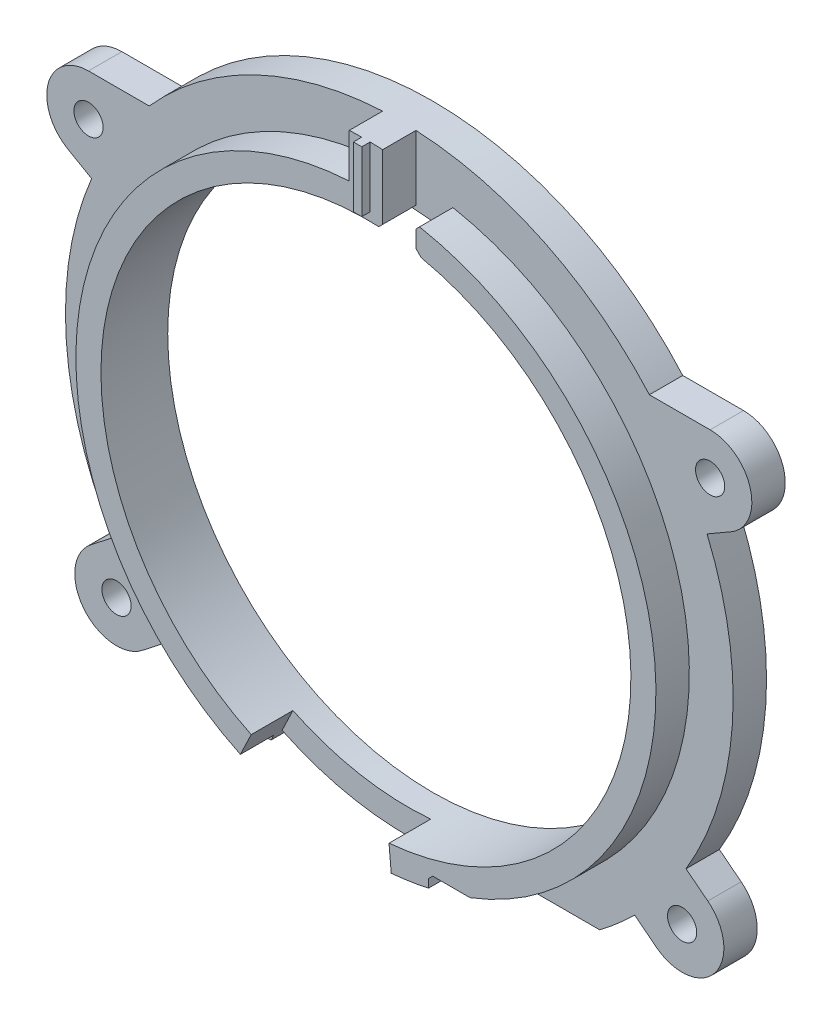
from build123d import *
from build123d.topology import SkipClean

# Parameters (mm, degrees)
SKETCH_1_R          = 40
SKETCH_1_R_2        = 31.75
EXTRUDE_1_DEPTH     = 4
EXTRUDE_START       = -4
SKETCH_2_R          = 1.75
EXTRUDE_2_DEPTH     = 4
CUT_EXTRUDE_2_DEPTH = 57.709787515
SKETCH_4_R          = 1.75
EXTRUDE_3_DEPTH     = 4
SKETCH_5_R          = 34.75
SKETCH_5_R_2        = 31.75
EXTRUDE_4_DEPTH     = 4
CUT_EXTRUDE_3_DEPTH = 59.310727346
EXTRUDE_5_DEPTH     = 4
EXTRUDE_6_DEPTH     = 1
CUT_EXTRUDE_START   = -2
CUT_EXTRUDE_4_DEPTH = 2
CUT_EXTRUDE_START_2 = -1
CUT_EXTRUDE_5_DEPTH = 1
CHAMFER_1_SIZE      = 1
SKETCH_11_W         = 4.981706152
SKETCH_11_H         = 1.5
CUT_EXTRUDE_6_DEPTH = 4
CHAMFER_2_SIZE      = 0.5
SKETCH_12_W         = 4
SKETCH_12_H         = 3.514481439
CUT_EXTRUDE_7_DEPTH = 4
CHAMFER_3_SIZE      = 0.5
SKETCH_13_W         = 1
SKETCH_13_H         = 1
CUT_EXTRUDE_8_DEPTH = 1


with BuildPart() as part:
    # 草图1 → 凸台-拉伸1 (new body)
    with BuildSketch(Plane.XY):
        Circle(SKETCH_1_R)
        Circle(SKETCH_1_R_2, mode=Mode.SUBTRACT)
    extrude(amount=EXTRUDE_1_DEPTH)

    # 草图2 → 凸台-拉伸2 (add)
    # profile 1 of 2: a face of its own
    with BuildSketch(Plane.XY.offset(4).offset(EXTRUDE_START)):
        with BuildLine():
            Line((-36.962769782, -22.533389671), (-34.351514644, -20.493253565))
            ThreePointArc((-34.351514644, -20.493253565), (-31.520430144, -24.626459013), (-28.194899891, -28.373361101))
            Line((-28.194899891, -28.373361101), (-30.806155028, -30.413497207))
            ThreePointArc((-30.806155028, -30.413497207), (-37.824516173, -29.551750816), (-36.962769782, -22.533389671))
        make_face()
        with Locations((-33.884462405, -26.473443439)):
            Circle(SKETCH_2_R, mode=Mode.SUBTRACT)
    # profile 2 of 2: a face of its own
    with BuildSketch(Plane.XY.offset(4).offset(EXTRUDE_START)):
        with BuildLine():
            Line((30.806155028, -30.413497207), (28.194899891, -28.373361101))
            ThreePointArc((28.194899891, -28.373361101), (31.520430144, -24.626459013), (34.351514644, -20.493253565))
            Line((34.351514644, -20.493253565), (36.962769782, -22.533389671))
            ThreePointArc((36.962769782, -22.533389671), (37.824516173, -29.551750816), (30.806155028, -30.413497207))
        make_face()
        with Locations((33.884462405, -26.473443439)):
            Circle(SKETCH_2_R, mode=Mode.SUBTRACT)
    extrude(amount=EXTRUDE_2_DEPTH)

    # 草图3 → 切除-拉伸2 (cut, through all)
    with BuildSketch(Plane.XY.offset(4)):
        with BuildLine():
            Line((-24, -32), (-15.370426149, -32))
            ThreePointArc((-15.370426149, -32), (0, -35.5), (15.370426149, -32))
            Line((15.370426149, -32), (24, -32))
            ThreePointArc((24, -32), (0, -40), (-24, -32))
        make_face()
    extrude(amount=-CUT_EXTRUDE_2_DEPTH, mode=Mode.SUBTRACT)

    # 草图4 → 凸台-拉伸3 (add)
    # profile 1 of 2: a face of its own
    with BuildSketch(Plane.XY.offset(4).offset(EXTRUDE_START)):
        with BuildLine():
            Line((-37.239092363, 26.5), (-29.962476533, 26.5))
            ThreePointArc((-29.962476533, 26.5), (-33.86444566, 21.288478578), (-36.869317712, 15.513007814))
            Line((-36.869317712, 15.513007814), (-39.739092363, 17.169872981))
            ThreePointArc((-39.739092363, 17.169872981), (-42.068721494, 22.794095226), (-37.239092363, 26.5))
        make_face()
        with Locations((-37.239092363, 21.5)):
            Circle(SKETCH_4_R, mode=Mode.SUBTRACT)
    # profile 2 of 2: a face of its own
    with BuildSketch(Plane.XY.offset(4).offset(EXTRUDE_START)):
        with BuildLine():
            Line((39.739092363, 17.169872981), (36.869317712, 15.513007814))
            ThreePointArc((36.869317712, 15.513007814), (33.86444566, 21.288478578), (29.962476533, 26.5))
            Line((29.962476533, 26.5), (37.239092363, 26.5))
            ThreePointArc((37.239092363, 26.5), (42.068721494, 22.794095226), (39.739092363, 17.169872981))
        make_face()
        with Locations((37.239092363, 21.5)):
            Circle(SKETCH_4_R, mode=Mode.SUBTRACT)
    extrude(amount=EXTRUDE_3_DEPTH)

    # 草图5 → 凸台-拉伸4 (add)
    with BuildSketch(Plane(origin=(0, 0, 4), x_dir=(-1, 0, 0), z_dir=(0, 0, -1))):
        Circle(SKETCH_5_R)
        Circle(SKETCH_5_R_2, mode=Mode.SUBTRACT)
    extrude(amount=-EXTRUDE_4_DEPTH)

    # 草图6 → 切除-拉伸3 (cut, through all)
    with SkipClean():  # the faces are left unmerged after this step: merging them gives an invalid solid
        with BuildSketch(Plane.XY.offset(4)):
            with BuildLine():
                Line((-15.045698836, -31.323943662), (-13.746789584, -28.61971831))
                ThreePointArc((-13.746789584, -28.61971831), (-5.692283606, -31.235563183), (2.767194832, -31.629181664))
                Line((2.767194832, -31.629181664), (3.02866206, -34.617765759))
                ThreePointArc((3.02866206, -34.617765759), (-6.230137175, -34.18695498), (-15.045698836, -31.323943662))
            make_face()
        extrude(amount=CUT_EXTRUDE_3_DEPTH, mode=Mode.SUBTRACT)

    # 草图7 → 凸台-拉伸5 (add)
    with SkipClean():  # the faces are left unmerged after this step: merging them gives an invalid solid
        with BuildSketch(Plane.XY.offset(4)):
            with BuildLine():
                Line((-2, 39.949968711), (-2, 34.692398303))
                ThreePointArc((-2, 34.692398303), (0, 34.75), (2, 34.692398303))
                Line((2, 34.692398303), (2, 39.949968711))
                ThreePointArc((2, 39.949968711), (0, 40), (-2, 39.949968711))
            make_face()
        extrude(amount=EXTRUDE_5_DEPTH)

    # 草图8 → 凸台-拉伸6 (add)
    with SkipClean():  # the faces are left unmerged after this step: merging them gives an invalid solid
        with BuildSketch(Plane.XY.offset(8)):
            with BuildLine():
                Line((-0.5, 39.996874878), (-0.5, 31.746062748))
                ThreePointArc((-0.5, 31.746062748), (0, 31.75), (0.5, 31.746062748))
                Line((0.5, 31.746062748), (0.5, 39.996874878))
                ThreePointArc((0.5, 39.996874878), (0, 40), (-0.5, 39.996874878))
            make_face()
        extrude(amount=EXTRUDE_6_DEPTH)

    # 草图9 → 切除-拉伸4 (cut)
    with SkipClean():  # the faces are left unmerged after this step: merging them gives an invalid solid
        with BuildSketch(Plane.XY.offset(4).offset(CUT_EXTRUDE_START)):
            with BuildLine():
                Line((-15.045698836, -31.323943662), (-15.370426149, -32))
                ThreePointArc((-15.370426149, -32), (-6.364600567, -34.924802929), (3.094028868, -35.364911782))
                Line((3.094028868, -35.364911782), (3.02866206, -34.617765759))
                ThreePointArc((3.02866206, -34.617765759), (-6.230137175, -34.18695498), (-15.045698836, -31.323943662))
            make_face()
        extrude(amount=CUT_EXTRUDE_4_DEPTH, mode=Mode.SUBTRACT)

    # 草图10 → 切除-拉伸5 (cut)
    with BuildSketch(Plane.XY.offset(4).offset(CUT_EXTRUDE_START_2)):
        with BuildLine():
            Line((3.02866206, -34.617765759), (2.767194832, -31.629181664))
            ThreePointArc((2.767194832, -31.629181664), (-5.692283606, -31.235563183), (-13.746789584, -28.61971831))
            Line((-13.746789584, -28.61971831), (-15.045698836, -31.323943662))
            ThreePointArc((-15.045698836, -31.323943662), (-6.230137175, -34.18695498), (3.02866206, -34.617765759))
        make_face()
    extrude(amount=CUT_EXTRUDE_5_DEPTH, mode=Mode.SUBTRACT)

    # 倒角1
    # the kernel refuses this chamfer: 1 mm, written as the material it adds along each edge
    with BuildSketch(Plane(origin=(0, 0, 2), x_dir=(0.1605769660987581, -0.9870233218918986, 0), z_dir=(0.9870233218918986, 0.1605769660987581, 0))) as chamfer_1_piece_1_section:
        Polygon((34.75 + CHAMFER_1_SIZE, 0), (34.75, -CHAMFER_1_SIZE), (34.75, 0), align=None)
    chamfer_1_piece_1 = revolve(axis=Axis((0, 0, 2), (0, 0, -1)), revolution_arc=39.1369501, mode=Mode.PRIVATE)
    chamfer_1_piece_1 = chamfer_1_piece_1 & Plane(origin=(0, 0, 2), x_dir=(-0.4329697506743493, -0.9014084507042253, 0), z_dir=(0, 0, 1)) * Cylinder(35.5, 143, mode=Mode.PRIVATE)
    add(chamfer_1_piece_1)

    # 草图11 → 切除-拉伸6 (cut)
    with BuildSketch(Plane.XY.offset(8)):
        with Locations((9.990853076, -33.180996154)):
            Rectangle(SKETCH_11_W, SKETCH_11_H)
    extrude(amount=-CUT_EXTRUDE_6_DEPTH, mode=Mode.SUBTRACT)

    # 倒角2
    chamfer_2_edges = [part.edges().sort_by_distance(p)[0] for p in [
        (7.5, -32.430996154, 6),
    ]]
    chamfer(chamfer_2_edges, length=CHAMFER_2_SIZE)

    # 草图12 → 切除-拉伸7 (cut)
    with BuildSketch(Plane.XY.offset(4)):
        with Locations((4, 32.935157584)):
            Rectangle(SKETCH_12_W, SKETCH_12_H)
    extrude(amount=CUT_EXTRUDE_7_DEPTH, mode=Mode.SUBTRACT)

    # 倒角3
    # the kernel refuses this chamfer: 0.630512845, 0.5, 0.471250803, 0.431912073 mm, written as the material it takes off along each edge
    with BuildSketch(Plane(origin=(2, 31.686945261, 9.285841494), x_dir=(0, 1, 0), z_dir=(0, 0, -1))) as chamfer_3_piece_1:
        with BuildLine():
            Line((CHAMFER_3_SIZE, 0), (0.026344876, -0.473655124))
            ThreePointArc((0.026344876, -0.473655124), (0.014426752, -0.243437323), (0, 0))
            Line((0, 0), (CHAMFER_3_SIZE, 0))
        make_face()
    extrude(amount=5.285841494, mode=Mode.SUBTRACT)
    with BuildSketch(Plane(origin=(6, 34.228095185, 9.285841494), x_dir=(0.9838938998328699, -0.17875344436308485, 0), z_dir=(0, 0, -1))) as chamfer_3_piece_2:
        with BuildLine():
            Line((0.430053019, 0), (CHAMFER_3_SIZE * 0.178753444363, CHAMFER_3_SIZE * 0.983893899833))
            Line((CHAMFER_3_SIZE * 0.178753444363, CHAMFER_3_SIZE * 0.983893899833), (0, 0))
            ThreePointArc((0, 0), (0.220718474, -0.000664812), (0.430053019, 0))
        make_face()
    extrude(amount=5.285841494, mode=Mode.SUBTRACT)
    with BuildSketch(Plane(origin=(6, 31.177916864, 4), x_dir=(0, 1, 0), z_dir=(0, 0, 1))) as chamfer_3_piece_3:
        with BuildLine():
            Line((CHAMFER_3_SIZE, 0), (-0.127287982, -0.627287982))
            ThreePointArc((-0.127287982, -0.627287982), (-0.064155933, -0.324269183), (0, 0))
            Line((0, 0), (CHAMFER_3_SIZE, 0))
        make_face()
    extrude(amount=5.653107156, mode=Mode.SUBTRACT)

    # 草图13 → 切除-拉伸8 (cut)
    with BuildSketch(Plane.XY.offset(8)):
        with Locations((0, 32.246062748)):
            Rectangle(SKETCH_13_W, SKETCH_13_H)
    extrude(amount=CUT_EXTRUDE_8_DEPTH, mode=Mode.SUBTRACT)


solid = part.part
